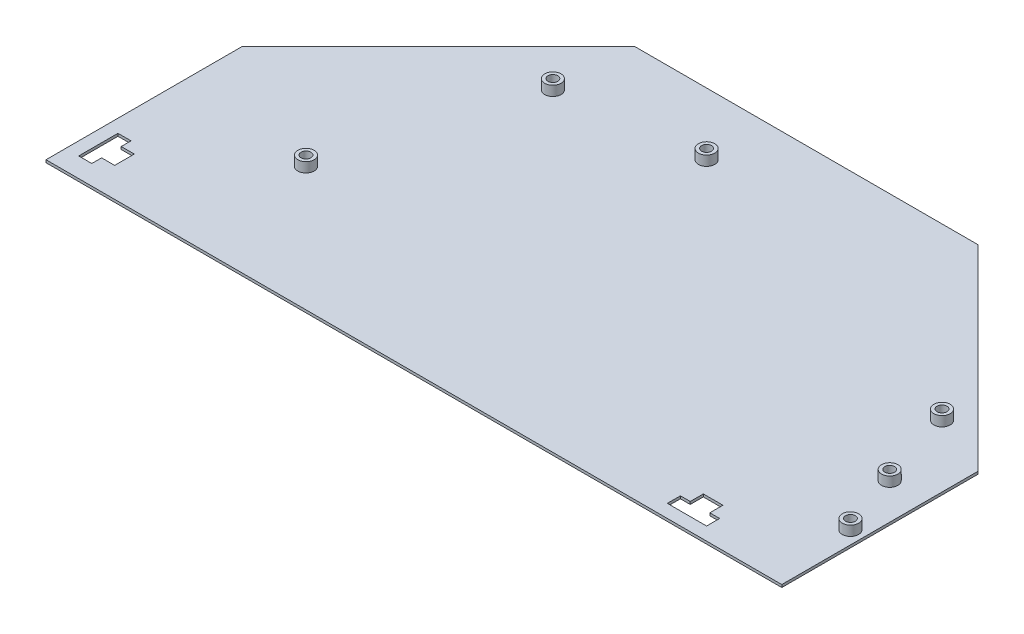
from build123d import *

# Parameters (mm, degrees)
SKETCH2_R                 = 2.5
BOSS_EXTRUDE1_DEPTH       = 3
BOSS_EXTRUDE1_2_DEPTH     = 3
BOSS_EXTRUDE1_3_DEPTH     = 3
BOSS_EXTRUDE1_4_DEPTH     = 3
BOSS_EXTRUDE1_5_DEPTH     = 3
BOSS_EXTRUDE1_6_DEPTH     = 3
SKETCH4_W                 = 225
SKETCH4_H                 = 120
BOSS_EXTRUDE2_DEPTH       = 0.8
F_3_0MM_DOWEL_HOLE1_D     = 3
F_3_0MM_DOWEL_HOLE1_DEPTH = 4
CUT_EXTRUDE1_REACH        = 257.018
CHAMFER1_SIZE             = 60


with BuildPart() as part:
    # Sketch2 → Boss-Extrude1 (new body)
    with BuildSketch(Plane(origin=(0, 0, 0), x_dir=(1, 0, 0), z_dir=(0, 1, 0))):
        with Locations((41.5, 38)):
            Circle(SKETCH2_R)
    extrude(amount=BOSS_EXTRUDE1_DEPTH)



with BuildPart() as body_2:
    # Sketch2 → Boss-Extrude1 2 (new body)
    with BuildSketch(Plane(origin=(0, 0, 0), x_dir=(1, 0, 0), z_dir=(0, 1, 0))):
        with Locations((59, 96)):
            Circle(SKETCH2_R)
    extrude(amount=BOSS_EXTRUDE1_2_DEPTH)


with BuildPart() as body_3:
    # Sketch2 → Boss-Extrude1 3 (new body)
    with BuildSketch(Plane(origin=(0, 0, 0), x_dir=(1, 0, 0), z_dir=(0, 1, 0))):
        with Locations((101, 101)):
            Circle(SKETCH2_R)
    extrude(amount=BOSS_EXTRUDE1_3_DEPTH)


with BuildPart() as body_4:
    # Sketch2 → Boss-Extrude1 4 (new body)
    with BuildSketch(Plane(origin=(0, 0, 0), x_dir=(1, 0, 0), z_dir=(0, 1, 0))):
        with Locations((206, 68)):
            Circle(SKETCH2_R)
    extrude(amount=BOSS_EXTRUDE1_4_DEPTH)


with BuildPart() as body_5:
    # Sketch2 → Boss-Extrude1 5 (new body)
    with BuildSketch(Plane(origin=(0, 0, 0), x_dir=(1, 0, 0), z_dir=(0, 1, 0))):
        with Locations((214, 44)):
            Circle(SKETCH2_R)
    extrude(amount=BOSS_EXTRUDE1_5_DEPTH)


with BuildPart() as body_6:
    # Sketch2 → Boss-Extrude1 6 (new body)
    with BuildSketch(Plane(origin=(0, 0, 0), x_dir=(1, 0, 0), z_dir=(0, 1, 0))):
        with Locations((221, 25)):
            Circle(SKETCH2_R)
    extrude(amount=BOSS_EXTRUDE1_6_DEPTH)


with BuildPart() as part_1:
    add(part.part)

    add(body_2.part)  # Boss-Extrude2 merges body 2

    add(body_3.part)  # Boss-Extrude2 merges body 3

    add(body_4.part)  # Boss-Extrude2 merges body 4

    add(body_5.part)  # Boss-Extrude2 merges body 5

    add(body_6.part)  # Boss-Extrude2 merges body 6
    # Sketch4 → Boss-Extrude2 (add)
    with BuildSketch(Plane(origin=(0, 0, 0), x_dir=(1, 0, 0), z_dir=(0, 1, 0))):
        with Locations((112.5, 60)):
            Rectangle(SKETCH4_W, SKETCH4_H)
    extrude(amount=-BOSS_EXTRUDE2_DEPTH)

    # Ø3.0mm Dowel Hole1
    with Locations(Plane(origin=(0, 3, 0), x_dir=(1, 0, 0), z_dir=(0, 1, 0))):
        with Locations((59, 96), (101, 101), (206, 68), (214, 44), (221, 25), (41.5, 38)):
            Hole(F_3_0MM_DOWEL_HOLE1_D / 2, depth=F_3_0MM_DOWEL_HOLE1_DEPTH)

    # Sketch27 → Cut-Extrude1 (cut, up to next)
    with BuildSketch(Plane(origin=(0, 0, 0), x_dir=(1, 0, 0), z_dir=(0, 1, 0)), mode=Mode.PRIVATE) as cut_extrude1_sk1:
        Polygon((186, 8), (189, 8), (189, 12), (195, 12), (195, 8), (198, 8), (198, 4), (186, 4), align=None)
    cut_extrude1_tool1 = extrude(cut_extrude1_sk1.sketch, amount=-CUT_EXTRUDE1_REACH, mode=Mode.PRIVATE) & part_1.part
    # Sketch27 → Cut-Extrude1 (cut, up to next)
    with BuildSketch(Plane(origin=(0, 0, 0), x_dir=(1, 0, 0), z_dir=(0, 1, 0)), mode=Mode.PRIVATE) as cut_extrude1_sk2:
        Polygon((4, 6), (8, 6), (8, 9), (12, 9), (12, 15), (8, 15), (8, 18), (4, 18), align=None)
    cut_extrude1_tool2 = extrude(cut_extrude1_sk2.sketch, amount=-CUT_EXTRUDE1_REACH, mode=Mode.PRIVATE) & part_1.part
    add(cut_extrude1_tool1.solids().sort_by_distance((192, 0, -7.333333))[0], mode=Mode.SUBTRACT)
    add(cut_extrude1_tool2.solids().sort_by_distance((7.333333, 0, -12))[0], mode=Mode.SUBTRACT)

    # Chamfer1
    chamfer1_edges = [part_1.edges().sort_by_distance(p)[0] for p in [
        (0, -0.4, -120),
        (225, -0.4, -120),
    ]]
    chamfer(chamfer1_edges, length=CHAMFER1_SIZE)


solid = part_1.part
